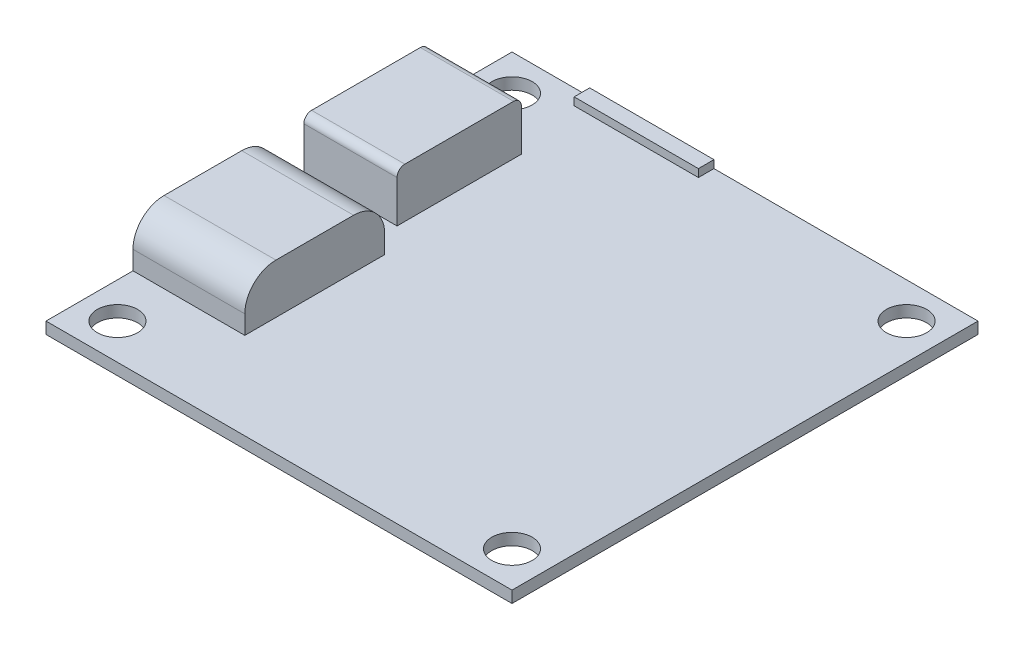
from build123d import *

# Parameters (mm, degrees)
SKETCH1_W               = 30
SKETCH1_H               = 30
BOSS_EXTRUDE1_DEPTH     = 0.375
SKETCH2_R               = 1.3
CUT_EXTRUDE1_DEPTH      = 22.226457547
MIRROR2_COPY_1_SKETCH_R = 1.3
MIRROR2_COPY_1_DEPTH    = 22.226457547
SKETCH3_W               = 7.2
SKETCH3_H               = 9
SKETCH3_W_2             = 6
SKETCH3_H_2             = 8
BOSS_EXTRUDE2_DEPTH     = 3.2
FILLET1_R               = 2
FILLET2_R               = 0.5
SKETCH4_W               = 8
SKETCH4_H               = 1
BOSS_EXTRUDE3_DEPTH     = 0.5


with BuildPart() as part:
    # Sketch1 → Boss-Extrude1 (new, symmetric)
    with BuildSketch(Plane(origin=(0, 0, 0), x_dir=(1, 0, 0), z_dir=(0, 1, 0))):
        Rectangle(SKETCH1_W, SKETCH1_H)
    extrude(amount=BOSS_EXTRUDE1_DEPTH, both=True)

    # Sketch2 → Cut-Extrude1 (cut, through all)
    with BuildSketch(Plane(origin=(0, 0.375, 0), x_dir=(1, 0, 0), z_dir=(0, 1, 0))):
        with Locations((-12.7, 12.7)):
            Circle(SKETCH2_R)
    cut_extrude1 = extrude(amount=-CUT_EXTRUDE1_DEPTH, mode=Mode.SUBTRACT)

    # Mirror1: Cut-Extrude1 across plane
    add(cut_extrude1.mirror(Plane(origin=(0, 0, 0), x_dir=(0, 0, 1), z_dir=(1, 0, 0))), mode=Mode.SUBTRACT)

    # Mirror2: Cut-Extrude1 across plane
    add(cut_extrude1.mirror(Plane.XY), mode=Mode.SUBTRACT)

    # Mirror2 copy 1 sketch → Mirror2 copy 1 (cut, through all)
    with BuildSketch(Plane(origin=(0, 0.375, 0), x_dir=(-1, 0, 0), z_dir=(0, 1, 0))):
        with Locations((-12.7, 12.7)):
            Circle(MIRROR2_COPY_1_SKETCH_R)
    extrude(amount=-MIRROR2_COPY_1_DEPTH, mode=Mode.SUBTRACT)

    # Sketch3 → Boss-Extrude2 (add)
    with BuildSketch(Plane(origin=(0, 0.375, 0), x_dir=(1, 0, 0), z_dir=(0, 1, 0))):
        with Locations((-11.4, -4.9)):
            Rectangle(SKETCH3_W, SKETCH3_H)
        with Locations((-12, 5.6)):
            Rectangle(SKETCH3_W_2, SKETCH3_H_2)
    extrude(amount=BOSS_EXTRUDE2_DEPTH)

    # Fillet1
    fillet1_edges = [part.edges().sort_by_distance(p)[0] for p in [
        (-11.4, 3.575, 0.4),
        (-11.4, 3.575, 9.4),
    ]]
    fillet(fillet1_edges, radius=FILLET1_R)

    # Fillet2
    fillet2_edges = [part.edges().sort_by_distance(p)[0] for p in [
        (-12, 3.575, -9.6),
        (-12, 3.575, -1.6),
    ]]
    fillet(fillet2_edges, radius=FILLET2_R)

    # Sketch4 → Boss-Extrude3 (add, symmetric)
    with BuildSketch(Plane(origin=(0, 0.375, 0), x_dir=(1, 0, 0), z_dir=(0, 1, 0))):
        with Locations((-6, 14.5)):
            Rectangle(SKETCH4_W, SKETCH4_H)
    extrude(amount=BOSS_EXTRUDE3_DEPTH, both=True)


solid = part.part
